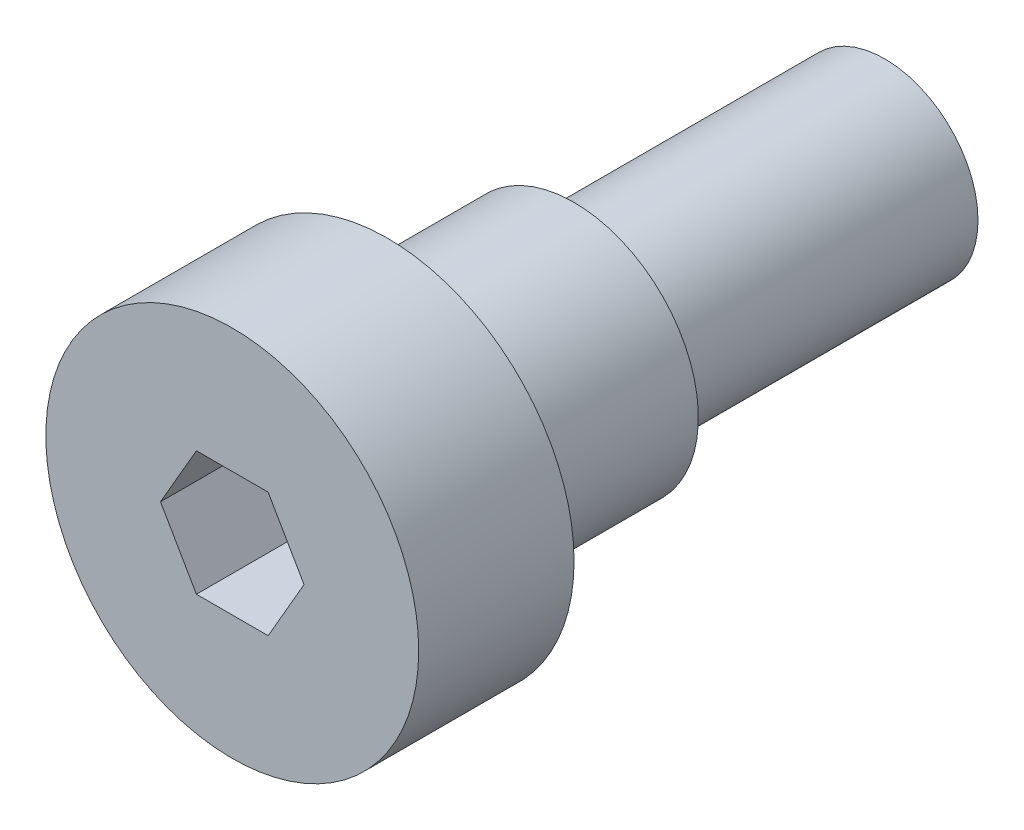
from build123d import *

# Parameters (mm, degrees)
SKETCH1_R           = 4.7625
BOSS_EXTRUDE1_DEPTH = 15.875
SKETCH2_R           = 6.35
BOSS_EXTRUDE2_DEPTH = 9.525
SKETCH3_R           = 9.525
BOSS_EXTRUDE3_DEPTH = 7.9375
CUT_EXTRUDE1_DEPTH  = 6.35


with BuildPart() as part:
    # Sketch1 → Boss-Extrude1 (new body)
    with BuildSketch(Plane.XY):
        Circle(SKETCH1_R)
    extrude(amount=BOSS_EXTRUDE1_DEPTH)

    # Sketch2 → Boss-Extrude2 (add)
    with BuildSketch(Plane.XY.offset(15.875)):
        Circle(SKETCH2_R)
    extrude(amount=BOSS_EXTRUDE2_DEPTH)

    # Sketch3 → Boss-Extrude3 (add)
    with BuildSketch(Plane.XY.offset(25.4)):
        Circle(SKETCH3_R)
    extrude(amount=BOSS_EXTRUDE3_DEPTH)

    # Sketch4 → Cut-Extrude1 (cut)
    with BuildSketch(Plane.XY.offset(33.3375)):
        Polygon((-3.666174209, 0), (-1.833087105, -3.175), (1.833087105, -3.175), (3.666174209, 0), (1.833087105, 3.175), (-1.833087105, 3.175), align=None)
    extrude(amount=-CUT_EXTRUDE1_DEPTH, mode=Mode.SUBTRACT)


solid = part.part
